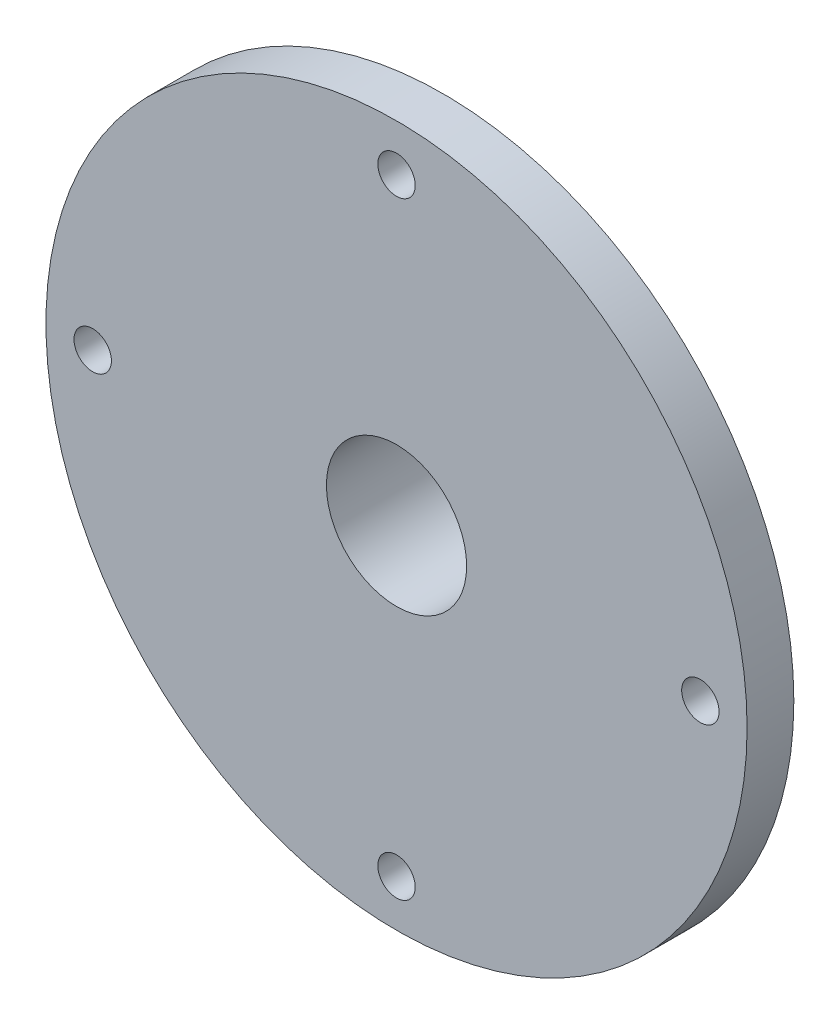
from build123d import *
from build123d.topology import SkipClean

# Parameters (mm, degrees)
SKETCH1_R           = 75
SKETCH1_R_2         = 15
SKETCH1_R_3         = 4
BOSS_EXTRUDE1_DEPTH = 10
BOSS_EXTRUDE2_START = 25
SKETCH2_R           = 24
SKETCH2_R_2         = 15
BOSS_EXTRUDE2_DEPTH = 25


with BuildPart() as part:
    # Sketch1 → Boss-Extrude1 (new body)
    with BuildSketch(Plane.XY):
        Circle(SKETCH1_R)
        Circle(SKETCH1_R_2, mode=Mode.SUBTRACT)
        with Locations((0, 65)):
            Circle(SKETCH1_R_3, mode=Mode.SUBTRACT)
        with Locations((-65, 0)):
            Circle(SKETCH1_R_3, mode=Mode.SUBTRACT)
        with Locations((0, -65)):
            Circle(SKETCH1_R_3, mode=Mode.SUBTRACT)
        with Locations((65, 0)):
            Circle(SKETCH1_R_3, mode=Mode.SUBTRACT)
    extrude(amount=BOSS_EXTRUDE1_DEPTH)

    # Sketch2 → Boss-Extrude2 (add)
    with SkipClean():  # the faces are left unmerged after this step: merging them gives an invalid solid
        with BuildSketch(Plane(origin=(0, 0, 0), x_dir=(-1, 0, 0), z_dir=(0, 0, -1)).offset(BOSS_EXTRUDE2_START)):
            Circle(SKETCH2_R)
            Circle(SKETCH2_R_2, mode=Mode.SUBTRACT)
        extrude(amount=-BOSS_EXTRUDE2_DEPTH)


solid = part.part
